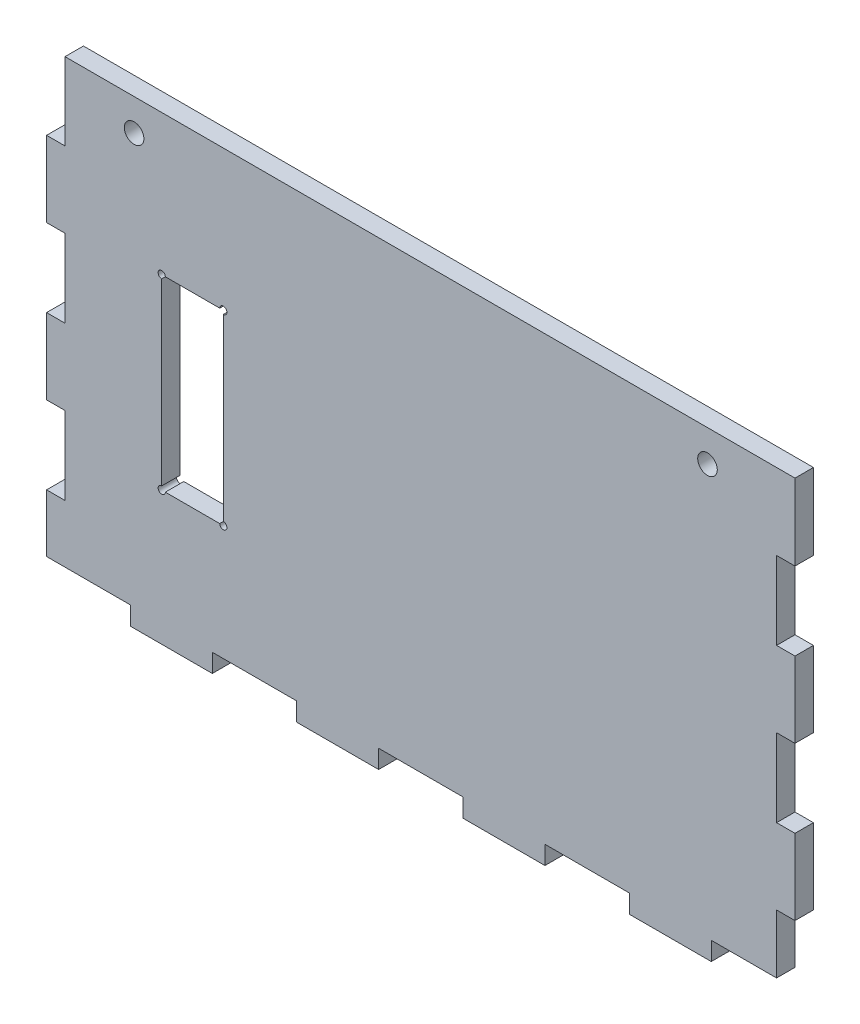
from build123d import *

# Parameters (mm, degrees)
SKETCH1_W             = 130
SKETCH1_H             = 80
BOSS_EXTRUDE1_DEPTH   = 3.2
SKETCH2_W             = 14.444444444
SKETCH2_H             = 3.2
SKETCH2_W_2           = 3.2
SKETCH2_H_2           = 13.333333334
SKETCH2_H_3           = 13.333333333
CUT_EXTRUDE1_DEPTH    = 153.676913775
CUT_EXTRUDE2_REACH    = 154.677
SKETCH3_R             = 1.7
CUT_EXTRUDE3_REACH    = 154.677
WIDTH_TOLERANCE_BY    = 0.1
WIDTH_TOLERANCE_2_BY  = 0.1
WIDTH_TOLERANCE_3_BY  = 0.1
WIDTH_TOLERANCE_4_BY  = 0.1
WIDTH_TOLERANCE_5_BY  = 0.1
WIDTH_TOLERANCE_6_BY  = 0.1
WIDTH_TOLERANCE_7_BY  = 0.1
WIDTH_TOLERANCE_8_BY  = 0.1
WIDTH_TOLERANCE_9_BY  = 0.1
WIDTH_TOLERANCE_10_BY = 0.1
WIDTH_TOLERANCE_11_BY = 0.1
WIDTH_TOLERANCE_12_BY = 0.1
WIDTH_TOLERANCE_13_BY = 0.1
WIDTH_TOLERANCE_14_BY = 0.1
WIDTH_TOLERANCE_15_BY = 0.1
WIDTH_TOLERANCE_16_BY = 0.1
WIDTH_TOLERANCE_17_BY = 0.1
WIDTH_TOLERANCE_18_BY = 0.1


with BuildPart() as part:
    # Sketch1 → Boss-Extrude1 (new body)
    with BuildSketch(Plane.XY):
        with Locations((65, 40)):
            Rectangle(SKETCH1_W, SKETCH1_H)
    extrude(amount=BOSS_EXTRUDE1_DEPTH)

    # Sketch2 → Cut-Extrude1 (cut, through all)
    with BuildSketch(Plane.XY.offset(3.2)):
        with Locations((7.222222222, 1.6)):
            Rectangle(SKETCH2_W, SKETCH2_H)
        with Locations((36.111111111, 1.6)):
            Rectangle(SKETCH2_W, SKETCH2_H)
        with Locations((65, 1.6)):
            Rectangle(SKETCH2_W, SKETCH2_H)
        with Locations((93.888888889, 1.6)):
            Rectangle(SKETCH2_W, SKETCH2_H)
        Polygon((115.555555556, 0), (115.555555556, 3.2), (126.8, 3.2), (126.8, 13.333333333), (130, 13.333333333), (130, 0), align=None)
        with Locations((1.6, 20)):
            Rectangle(SKETCH2_W_2, SKETCH2_H_2)
        with Locations((1.6, 46.666666667)):
            Rectangle(SKETCH2_W_2, SKETCH2_H_3)
        with Locations((1.6, 73.333333334)):
            Rectangle(SKETCH2_W_2, SKETCH2_H_3)
        with Locations((128.4, 33.333333334)):
            Rectangle(SKETCH2_W_2, SKETCH2_H_3)
        with Locations((128.4, 60)):
            Rectangle(SKETCH2_W_2, SKETCH2_H_2)
    extrude(amount=-CUT_EXTRUDE1_DEPTH, mode=Mode.SUBTRACT)

    # Sketch3 → Cut-Extrude2 (cut, up to next)
    with BuildSketch(Plane.XY.offset(3.2), mode=Mode.PRIVATE) as cut_extrude2_sk1:
        with Locations((15.2, 74.5)):
            Circle(SKETCH3_R)
    cut_extrude2_tool1 = extrude(cut_extrude2_sk1.sketch, amount=-CUT_EXTRUDE2_REACH, mode=Mode.PRIVATE) & part.part
    # Sketch3 → Cut-Extrude2 (cut, up to next)
    with BuildSketch(Plane.XY.offset(3.2), mode=Mode.PRIVATE) as cut_extrude2_sk2:
        with Locations((114.8, 74.5)):
            Circle(SKETCH3_R)
    cut_extrude2_tool2 = extrude(cut_extrude2_sk2.sketch, amount=-CUT_EXTRUDE2_REACH, mode=Mode.PRIVATE) & part.part
    add(cut_extrude2_tool1.solids().sort_by_distance((15.2, 74.5, 3.2))[0], mode=Mode.SUBTRACT)
    add(cut_extrude2_tool2.solids().sort_by_distance((114.8, 74.5, 3.2))[0], mode=Mode.SUBTRACT)

    # Sketch4 → Cut-Extrude3 (cut, up to next)
    with BuildSketch(Plane(origin=(0, 0, 0), x_dir=(-1, 0, 0), z_dir=(0, 0, -1)), mode=Mode.PRIVATE) as cut_extrude3_sk1:
        with BuildLine():
            Line((-30.075, 55.6), (-20.625, 55.6))
            ThreePointArc((-20.625, 55.6), (-19.558058262, 56.041941738), (-20, 54.975))
            Line((-20, 54.975), (-20, 23.825))
            ThreePointArc((-20, 23.825), (-19.558058262, 22.758058262), (-20.625, 23.2))
            Line((-20.625, 23.2), (-30.075, 23.2))
            ThreePointArc((-30.075, 23.2), (-31.141941738, 22.758058262), (-30.7, 23.825))
            Line((-30.7, 23.825), (-30.7, 54.975))
            ThreePointArc((-30.7, 54.975), (-31.141941738, 56.041941738), (-30.075, 55.6))
        make_face()
    cut_extrude3_tool1 = extrude(cut_extrude3_sk1.sketch, amount=-CUT_EXTRUDE3_REACH, mode=Mode.PRIVATE) & part.part
    add(cut_extrude3_tool1.solids().sort_by_distance((25.35, 39.4, 0))[0], mode=Mode.SUBTRACT)

    # Width tolerance: a face moved inward by 0.1
    extrude(part.faces().sort_by_distance((1.6, 26.666666667, 1.6))[0], amount=WIDTH_TOLERANCE_BY, dir=(0, 1, 0), mode=Mode.SUBTRACT)

    # Width tolerance 2: a face moved inward by 0.1
    extrude(part.faces().sort_by_distance((1.6, 53.333333333, 1.6))[0], amount=WIDTH_TOLERANCE_2_BY, dir=(0, 1, 0), mode=Mode.SUBTRACT)

    # Width tolerance 3: a face moved inward by 0.1
    extrude(part.faces().sort_by_distance((1.6, 66.666666667, 1.6))[0], amount=WIDTH_TOLERANCE_3_BY, dir=(0, -1, 0), mode=Mode.SUBTRACT)

    # Width tolerance 4: a face moved inward by 0.1
    extrude(part.faces().sort_by_distance((1.6, 40, 1.6))[0], amount=WIDTH_TOLERANCE_4_BY, dir=(0, -1, 0), mode=Mode.SUBTRACT)

    # Width tolerance 5: a face moved inward by 0.1
    extrude(part.faces().sort_by_distance((1.6, 13.333333333, 1.6))[0], amount=WIDTH_TOLERANCE_5_BY, dir=(0, -1, 0), mode=Mode.SUBTRACT)

    # Width tolerance 6: a face moved inward by 0.1
    extrude(part.faces().sort_by_distance((128.4, 66.666666667, 1.6))[0], amount=WIDTH_TOLERANCE_6_BY, dir=(0, 1, 0), mode=Mode.SUBTRACT)

    # Width tolerance 7: a face moved inward by 0.1
    extrude(part.faces().sort_by_distance((128.4, 40, 1.6))[0], amount=WIDTH_TOLERANCE_7_BY, dir=(0, 1, 0), mode=Mode.SUBTRACT)

    # Width tolerance 8: a face moved inward by 0.1
    extrude(part.faces().sort_by_distance((128.4, 53.333333333, 1.6))[0], amount=WIDTH_TOLERANCE_8_BY, dir=(0, -1, 0), mode=Mode.SUBTRACT)

    # Width tolerance 9: a face moved inward by 0.1
    extrude(part.faces().sort_by_distance((128.4, 26.666666667, 1.6))[0], amount=WIDTH_TOLERANCE_9_BY, dir=(0, -1, 0), mode=Mode.SUBTRACT)

    # Width tolerance 10: a face moved inward by 0.1
    extrude(part.faces().sort_by_distance((128.4, 13.333333333, 1.6))[0], amount=WIDTH_TOLERANCE_10_BY, dir=(0, 1, 0), mode=Mode.SUBTRACT)

    # Width tolerance 11: a face moved inward by 0.1
    extrude(part.faces().sort_by_distance((101.111111111, 1.6, 1.6))[0], amount=WIDTH_TOLERANCE_11_BY, dir=(1, 0, 0), mode=Mode.SUBTRACT)

    # Width tolerance 12: a face moved inward by 0.1
    extrude(part.faces().sort_by_distance((115.555555556, 1.6, 1.6))[0], amount=WIDTH_TOLERANCE_12_BY, dir=(-1, 0, 0), mode=Mode.SUBTRACT)

    # Width tolerance 13: a face moved inward by 0.1
    extrude(part.faces().sort_by_distance((86.666666667, 1.6, 1.6))[0], amount=WIDTH_TOLERANCE_13_BY, dir=(-1, 0, 0), mode=Mode.SUBTRACT)

    # Width tolerance 14: a face moved inward by 0.1
    extrude(part.faces().sort_by_distance((72.222222222, 1.6, 1.6))[0], amount=WIDTH_TOLERANCE_14_BY, dir=(1, 0, 0), mode=Mode.SUBTRACT)

    # Width tolerance 15: a face moved inward by 0.1
    extrude(part.faces().sort_by_distance((43.333333333, 1.6, 1.6))[0], amount=WIDTH_TOLERANCE_15_BY, dir=(1, 0, 0), mode=Mode.SUBTRACT)

    # Width tolerance 16: a face moved inward by 0.1
    extrude(part.faces().sort_by_distance((57.777777778, 1.6, 1.6))[0], amount=WIDTH_TOLERANCE_16_BY, dir=(-1, 0, 0), mode=Mode.SUBTRACT)

    # Width tolerance 17: a face moved inward by 0.1
    extrude(part.faces().sort_by_distance((28.888888889, 1.6, 1.6))[0], amount=WIDTH_TOLERANCE_17_BY, dir=(-1, 0, 0), mode=Mode.SUBTRACT)

    # Width tolerance 18: a face moved inward by 0.1
    extrude(part.faces().sort_by_distance((14.444444444, 1.6, 1.6))[0], amount=WIDTH_TOLERANCE_18_BY, dir=(1, 0, 0), mode=Mode.SUBTRACT)


solid = part.part
